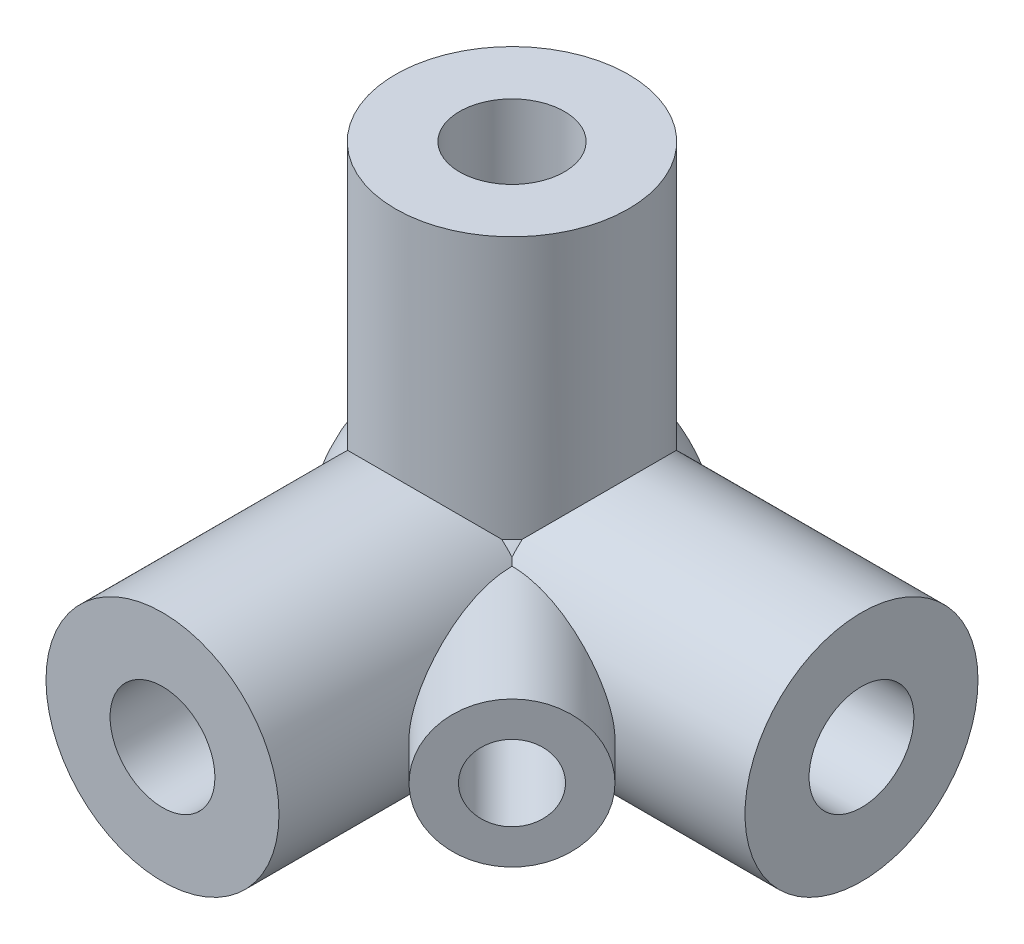
from build123d import *

# Parameters (mm, degrees)
SKETCH_2_R          = 2
EXTRUDE_1_DEPTH     = 6
SKETCH_3_R          = 2
EXTRUDE_2_DEPTH     = 6
SKETCH_4_R          = 2
EXTRUDE_3_DEPTH     = 6
SKETCH_6_R          = 0.9
CUT_EXTRUDE_1_DEPTH = 5
SKETCH_10_R         = 1.25
EXTRUDE_4_DEPTH     = 5
SKETCH_7_R          = 0.9
CUT_EXTRUDE_2_DEPTH = 5
SKETCH_8_R          = 0.9
CUT_EXTRUDE_3_DEPTH = 5
SKETCH_14_R         = 0.65
CUT_EXTRUDE_4_DEPTH = 3


with BuildPart() as part:
    # 草图2 → 凸台-拉伸1 (new body)
    with BuildSketch(Plane(origin=(0, 0, 0), x_dir=(1, 0, 0), z_dir=(0, 1, 0))):
        Circle(SKETCH_2_R)
    extrude(amount=EXTRUDE_1_DEPTH)

    # 草图3 → 凸台-拉伸2 (add)
    with BuildSketch(Plane.XY):
        Circle(SKETCH_3_R)
    extrude(amount=EXTRUDE_2_DEPTH)

    # 草图4 → 凸台-拉伸3 (add)
    with BuildSketch(Plane(origin=(0, 0, 0), x_dir=(0, 0, -1), z_dir=(1, 0, 0))):
        Circle(SKETCH_4_R)
    extrude(amount=EXTRUDE_3_DEPTH)

    # 草图5 → 旋转3 (revolve)
    with BuildSketch(Plane(origin=(0, 0, 0), x_dir=(1, 0, 0), z_dir=(0, 1, 0))):
        with BuildLine():
            Line((0, 2.5), (0, -2.5))
            ThreePointArc((0, -2.5), (-2.5, 0), (0, 2.5))
        make_face()
    revolve(axis=Axis((0, 0, -2.5), (0, 0, 1)))

    # 草图6 → 切除-拉伸1 (cut)
    with BuildSketch(Plane(origin=(0, 6, 0), x_dir=(1, 0, 0), z_dir=(0, 1, 0))):
        Circle(SKETCH_6_R)
    extrude(amount=-CUT_EXTRUDE_1_DEPTH, mode=Mode.SUBTRACT)

    # 草图10 → 凸台-拉伸4 (add)
    with BuildSketch(Plane(origin=(0, 0, 0), x_dir=(0.7071067811865461, 0, -0.707106781186549), z_dir=(0.707106781186549, 0, 0.7071067811865461))):
        Circle(SKETCH_10_R)
    extrude(amount=EXTRUDE_4_DEPTH)

    # 草图7 → 切除-拉伸2 (cut)
    with BuildSketch(Plane(origin=(6, 0, 0), x_dir=(0, 0, -1), z_dir=(1, 0, 0))):
        Circle(SKETCH_7_R)
    extrude(amount=-CUT_EXTRUDE_2_DEPTH, mode=Mode.SUBTRACT)

    # 草图8 → 切除-拉伸3 (cut)
    with BuildSketch(Plane.XY.offset(6)):
        Circle(SKETCH_8_R)
    extrude(amount=-CUT_EXTRUDE_3_DEPTH, mode=Mode.SUBTRACT)

    # 草图14 → 切除-拉伸4 (cut)
    with BuildSketch(Plane(origin=(3.535533906, 0, 3.535533906), x_dir=(0.7071067811865462, 0, -0.7071067811865489), z_dir=(0.7071067811865489, 0, 0.7071067811865462))):
        Circle(SKETCH_14_R)
    extrude(amount=-CUT_EXTRUDE_4_DEPTH, mode=Mode.SUBTRACT)


solid = part.part
